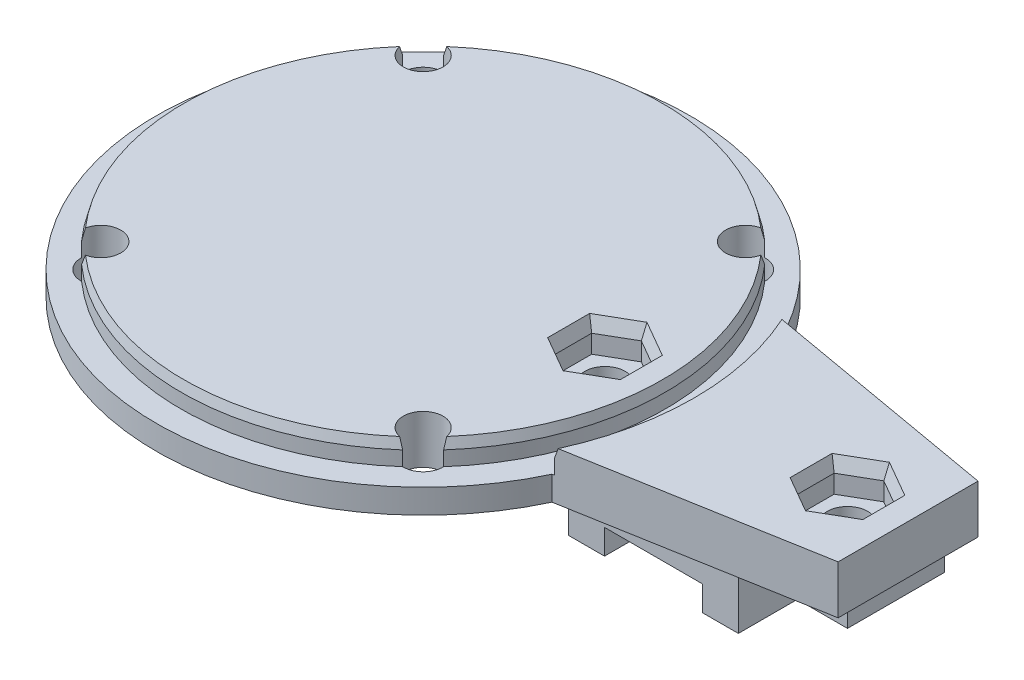
from build123d import *
from OCP.BRepFilletAPI import BRepFilletAPI_MakeChamfer

# Parameters (mm, degrees)
SKETCH_1_R          = 55
EXTRUDE_1_DEPTH     = 5
SKETCH_2_R          = 49.9
EXTRUDE_2_DEPTH     = 5
SKETCH7_W           = 51.010205144
SKETCH7_H           = 50
BOSS_EXTRUDE2_DEPTH = 5
SKETCH_3_W          = 35
SKETCH_3_H          = 30
EXTRUDE_3_DEPTH     = 25
SKETCH_4_W          = 20.2
SKETCH_4_H          = 10.3
CUT_EXTRUDE_1_DEPTH = 125.599357944
SKETCH_5_R          = 4.1
CUT_EXTRUDE_2_DEPTH = 117.833214455
CHAMFER1_SIZE       = 2
CHAMFER1_SIZE2      = 0.535898385
SKETCH2_W           = 35
SKETCH2_H           = 30
CUT_EXTRUDE1_DEPTH  = 12.5
BOSS_EXTRUDE1_START = -2
SKETCH4_W           = 70
SKETCH4_H           = 20
BOSS_EXTRUDE1_DEPTH = 5.35
SKETCH5_R           = 4.15
CUT_EXTRUDE2_DEPTH  = 116.154776293
SKETCH9_R           = 4.15
BOSS_EXTRUDE3_DEPTH = 5
CHAMFER3_SIZE       = 2
CHAMFER3_SIZE2      = 0.535898385
CUT_EXTRUDE3_DEPTH  = 6.5
CHAMFER2_SIZE       = 1
CHAMFER2_SIZE2      = 2.747477419
CHAMFER4_SIZE       = 10.579618843
CHAMFER4_SIZE_2     = 60


with BuildPart() as part:
    # Эскиз1 → Бобышка-Вытянуть1 (new body)
    with BuildSketch(Plane(origin=(0, 0, 0), x_dir=(1, 0, 0), z_dir=(0, 1, 0))):
        with Locations(Location((0, 0, 0), (0, 0, 270))):
            Circle(SKETCH_1_R)
    extrude(amount=EXTRUDE_1_DEPTH)

    # Эскиз2 → Бобышка-Вытянуть2 (add)
    with BuildSketch(Plane(origin=(0, 5, 0), x_dir=(1, 0, 0), z_dir=(0, 1, 0))):
        with Locations(Location((0, 0, 0), (0, 0, 270))):
            Circle(SKETCH_2_R)
    extrude(amount=EXTRUDE_2_DEPTH)

    # Sketch7 → Boss-Extrude2 (add)
    with BuildSketch(Plane.XZ):
        with Locations((74.494897428, 0)):
            Rectangle(SKETCH7_W, SKETCH7_H)
    extrude(amount=-BOSS_EXTRUDE2_DEPTH)

    # Эскиз3 → Бобышка-Вытянуть3 (add)
    with BuildSketch(Plane.XZ):
        with Locations((62.5, 0)):
            Rectangle(SKETCH_3_W, SKETCH_3_H)
    extrude(amount=EXTRUDE_3_DEPTH)

    # Эскиз4 → Вырез-Вытянуть1 (cut, through all)
    with BuildSketch(Plane.XY.offset(15)):
        with Locations((62.5, -12.5)):
            Rectangle(SKETCH_4_W, SKETCH_4_H)
    extrude(amount=-CUT_EXTRUDE_1_DEPTH, mode=Mode.SUBTRACT)

    # Эскиз5 → Вырез-Вытянуть2 (cut, through all)
    with BuildSketch(Plane.XZ):
        with Locations(Location((33.234018716, -33.234018716, 0), (0, 0, 270))):
            Circle(SKETCH_5_R)
        with Locations(Location((-33.234018716, -33.234018716, 0), (0, 0, 270))):
            Circle(SKETCH_5_R)
        with Locations(Location((-33.234018716, 33.234018716, 0), (0, 0, 270))):
            Circle(SKETCH_5_R)
        with Locations(Location((33.234018716, 33.234018716, 0), (0, 0, 270))):
            Circle(SKETCH_5_R)
    extrude(amount=-CUT_EXTRUDE_2_DEPTH, mode=Mode.SUBTRACT)

    # Chamfer1: one chamfer whose edges measure the first distance from different faces: ONE call of the kernel's chamfer builder (chamfer() names one face for all edges)
    chamfer1_edges_1 = [part.edges().sort_by_distance(p)[0] for p in [
        (0, 10, -49.9),
    ]]
    chamfer1_side_1 = [part.faces().sort_by_distance(p)[0] for p in [
        (0, 7.5, -49.9),
    ]]
    chamfer1_edges_2 = [part.edges().sort_by_distance(p)[0] for p in [
        (-49.9, 10, 0),
    ]]
    chamfer1_side_2 = [part.faces().sort_by_distance(p)[0] for p in [
        (-49.9, 7.5, 0),
    ]]
    chamfer1_edges_3 = [part.edges().sort_by_distance(p)[0] for p in [
        (0, 10, 49.9),
    ]]
    chamfer1_side_3 = [part.faces().sort_by_distance(p)[0] for p in [
        (0, 7.5, 49.9),
    ]]
    chamfer1_edges_4 = [part.edges().sort_by_distance(p)[0] for p in [
        (49.9, 10, 0),
    ]]
    chamfer1_side_4 = [part.faces().sort_by_distance(p)[0] for p in [
        (49.9, 7.5, 0),
    ]]
    chamfer1 = BRepFilletAPI_MakeChamfer(part.part.solid().wrapped)
    for e in chamfer1_edges_1:
        chamfer1.Add(CHAMFER1_SIZE, CHAMFER1_SIZE2, e.wrapped, chamfer1_side_1[0].wrapped)  # the first distance lies on this face
    for e in chamfer1_edges_2:
        chamfer1.Add(CHAMFER1_SIZE, CHAMFER1_SIZE2, e.wrapped, chamfer1_side_2[0].wrapped)  # the first distance lies on this face
    for e in chamfer1_edges_3:
        chamfer1.Add(CHAMFER1_SIZE, CHAMFER1_SIZE2, e.wrapped, chamfer1_side_3[0].wrapped)  # the first distance lies on this face
    for e in chamfer1_edges_4:
        chamfer1.Add(CHAMFER1_SIZE, CHAMFER1_SIZE2, e.wrapped, chamfer1_side_4[0].wrapped)  # the first distance lies on this face
    add(Compound.cast(chamfer1.Shape()), mode=Mode.REPLACE)

    # Sketch2 → Cut-Extrude1 (cut)
    with BuildSketch(Plane.XZ.offset(25)):
        with Locations((62.5, 0)):
            Rectangle(SKETCH2_W, SKETCH2_H)
    extrude(amount=-CUT_EXTRUDE1_DEPTH, mode=Mode.SUBTRACT)

    # Sketch4 → Boss-Extrude1 (add)
    with BuildSketch(Plane.XZ.offset(7.35).offset(BOSS_EXTRUDE1_START)):
        with Locations((62.5, 0)):
            Rectangle(SKETCH4_W, SKETCH4_H)
    extrude(amount=-BOSS_EXTRUDE1_DEPTH)

    # Sketch5 → Cut-Extrude2 (cut, through all)
    with BuildSketch(Plane.XZ.offset(5.35)):
        with Locations((87.5, 0)):
            Circle(SKETCH5_R)
        with Locations((37.5, 0)):
            Circle(SKETCH5_R)
    extrude(amount=-CUT_EXTRUDE2_DEPTH, mode=Mode.SUBTRACT)

    # Sketch9 → Boss-Extrude3 (add)
    # profile 1 of 2: a face of its own
    with BuildSketch(Plane(origin=(0, 5, 0), x_dir=(1, 0, 0), z_dir=(0, 1, 0))):
        with Locations((37.5, 0)):
            Circle(SKETCH9_R)
    # profile 2 of 2: a face of its own
    with BuildSketch(Plane(origin=(0, 5, 0), x_dir=(1, 0, 0), z_dir=(0, 1, 0))):
        with BuildLine():
            Line((49.389794856, -25), (100, -25))
            Line((100, -25), (100, 25))
            Line((100, 25), (49.389794856, 25))
            ThreePointArc((49.389794856, 25), (55.356588008, 0), (49.389794856, -25))
        make_face()
        with Locations((87.5, 0)):
            Circle(SKETCH9_R, mode=Mode.SUBTRACT)
    extrude(amount=BOSS_EXTRUDE3_DEPTH)

    # Chamfer3
    chamfer3_edges = [part.edges().sort_by_distance(p)[0] for p in [
        (55.356588008, 10, 0),
    ]]
    chamfer3_side = [part.faces().sort_by_distance(p)[0] for p in [
        (55.356588008, 7.5, 0),
    ]]
    chamfer(chamfer3_edges, length=CHAMFER3_SIZE, length2=CHAMFER3_SIZE2, reference=chamfer3_side[0])

    # Sketch6 → Cut-Extrude3 (cut)
    with BuildSketch(Plane(origin=(0, 10, 0), x_dir=(1, 0, 0), z_dir=(0, 1, 0))):
        Polygon((43.995190528, 3.75), (37.5, 7.5), (31.004809472, 3.75), (31.004809472, -3.75), (37.5, -7.5), (43.995190528, -3.75), align=None)
        Polygon((93.995190528, 3.75), (87.5, 7.5), (81.004809472, 3.75), (81.004809472, -3.75), (87.5, -7.5), (93.995190528, -3.75), align=None)
    extrude(amount=-CUT_EXTRUDE3_DEPTH, mode=Mode.SUBTRACT)

    # Chamfer2: one chamfer whose edges measure the first distance from different faces: ONE call of the kernel's chamfer builder (chamfer() names one face for all edges)
    chamfer2_edges_1 = [part.edges().sort_by_distance(p)[0] for p in [
        (43.995190528, 10, 0),
        (40.747595264, 10, -5.625),
        (34.252404736, 10, -5.625),
        (31.004809472, 10, 0),
        (34.252404736, 10, 5.625),
        (40.747595264, 10, 5.625),
    ]]
    chamfer2_side_1 = [part.faces().sort_by_distance(p)[0] for p in [
        (-0.7474754, 10, 0),
    ]]
    chamfer2_edges_2 = [part.edges().sort_by_distance(p)[0] for p in [
        (93.995190528, 10, 0),
        (90.747595264, 10, -5.625),
        (84.252404736, 10, -5.625),
        (81.004809472, 10, 0),
        (84.252404736, 10, 5.625),
        (90.747595264, 10, 5.625),
    ]]
    chamfer2_side_2 = [part.faces().sort_by_distance(p)[0] for p in [
        (76.23589774, 10, 0),
    ]]
    chamfer2 = BRepFilletAPI_MakeChamfer(part.part.solid().wrapped)
    for e in chamfer2_edges_1:
        chamfer2.Add(CHAMFER2_SIZE, CHAMFER2_SIZE2, e.wrapped, chamfer2_side_1[0].wrapped)  # the first distance lies on this face
    for e in chamfer2_edges_2:
        chamfer2.Add(CHAMFER2_SIZE, CHAMFER2_SIZE2, e.wrapped, chamfer2_side_2[0].wrapped)  # the first distance lies on this face
    add(Compound.cast(chamfer2.Shape()), mode=Mode.REPLACE)

    # Chamfer4
    # the kernel refuses this chamfer: 60, 10.579618843 mm, written as the material it takes off along each edge
    with BuildSketch(Plane(origin=(100, 165.912327785, -25), x_dir=(0.21013876076743138, 0, 0.9776715712462587), z_dir=(0, -1, 0))) as chamfer4_piece_1_section:
        Polygon((CHAMFER4_SIZE * 0.977671571201, CHAMFER4_SIZE * 0.210138760758), (-CHAMFER4_SIZE_2 * 0.210138760767, CHAMFER4_SIZE_2 * 0.977671571246), (0, 0), align=None)
    chamfer4_piece_1 = extrude(amount=321.824655571, mode=Mode.PRIVATE)
    chamfer4_piece_1 = chamfer4_piece_1 - Plane(origin=(0, 7.498692245, 0), x_dir=(0, 0, 1), z_dir=(0, -1, 0)) * Cylinder(55, 879, mode=Mode.PRIVATE)
    add(chamfer4_piece_1, mode=Mode.SUBTRACT)
    with BuildSketch(Plane(origin=(100, -155.912327785, 25), x_dir=(-0.9999776716360547, 0, 0.006682531656101301), z_dir=(0, 1, 0))) as chamfer4_piece_2_section:
        Polygon((CHAMFER4_SIZE_2 * 0.999977671636, -CHAMFER4_SIZE_2 * 0.0066825316561), (-CHAMFER4_SIZE * 0.00668253165579, -CHAMFER4_SIZE * 0.99997767159), (0, 0), align=None)
    chamfer4_piece_2 = extrude(amount=321.824655571, mode=Mode.PRIVATE)
    chamfer4_piece_2 = chamfer4_piece_2 - Plane(origin=(0, 2.5, 0), x_dir=(0, 0, 1), z_dir=(0, -1, 0)) * Cylinder(55, 884, mode=Mode.PRIVATE)
    add(chamfer4_piece_2, mode=Mode.SUBTRACT)


solid = part.part
